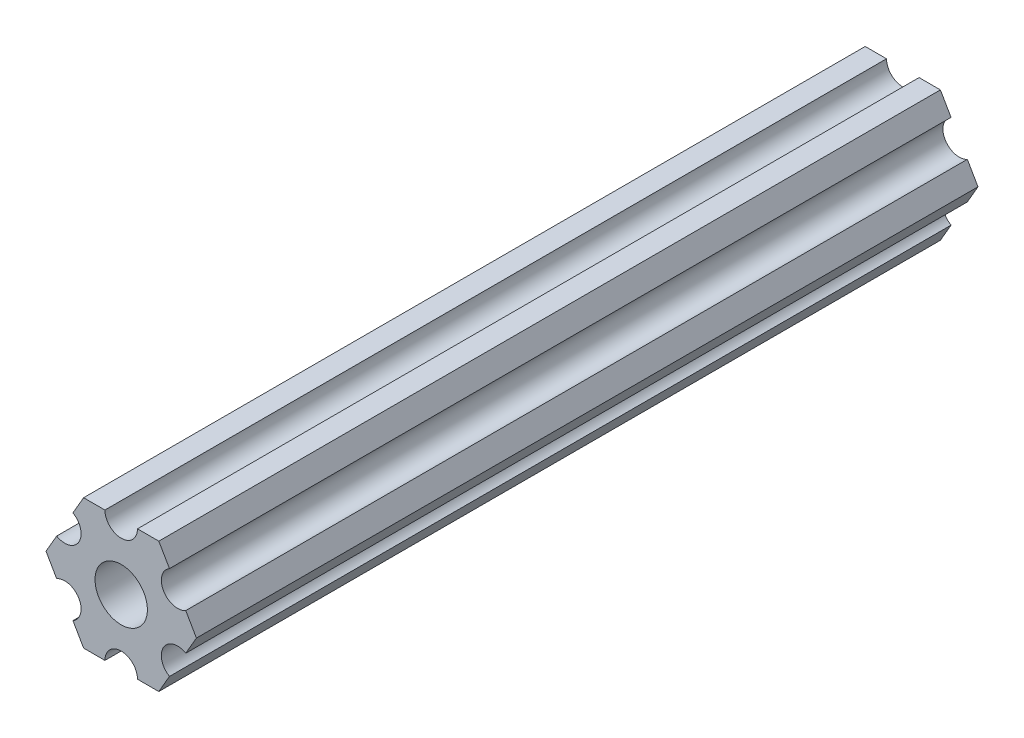
from build123d import *

# Parameters (mm, degrees)
BOSS_EXTRUDE1_DEPTH             = 76.2
F_1_4_20_START                  = -76.2
F_1_4_20_TAPPED_HOLE2_OUTLINE_R = 2.5527
F_1_4_20_TAPPED_HOLE2_DEPTH     = 76.2


# Read off the part's stored shape, not the designer's step: 1/4-20 Tapped Hole2
with BuildPart() as part:
    # Sketch1 → Boss-Extrude1 (new body)
    with BuildSketch(Plane.XY):
        with BuildLine():
            Line((-4.70551159, -4.549815043), (-3.666174521, -6.349999904))
            Line((-3.666174521, -6.349999904), (-1.587501923, -6.349999904))
            ThreePointArc((-1.587501923, -6.349999904), (-3.85e-07, -4.762498365), (1.587501923, -6.349999904))
            Line((1.587501923, -6.349999904), (3.666173825, -6.349999904))
            Line((3.666173825, -6.349999904), (4.705510929, -4.549815232))
            ThreePointArc((4.705510929, -4.549815232), (4.124445601, -2.381249904), (6.293010929, -1.800184575))
            Line((6.293010929, -1.800184575), (7.332348034, 9.6e-08))
            Line((7.332348034, 9.6e-08), (6.293011178, 1.800184715))
            ThreePointArc((6.293011178, 1.800184715), (4.124445902, 2.381250241), (4.705511428, 4.549815516))
            Line((4.705511428, 4.549815516), (3.666174521, 6.350000222))
            Line((3.666174521, 6.350000222), (1.587498077, 6.350000222))
            ThreePointArc((1.587498077, 6.350000222), (3.85e-07, 4.76250253), (-1.587498077, 6.350000222))
            Line((-1.587498077, 6.350000222), (-3.666173825, 6.350000222))
            Line((-3.666173825, 6.350000222), (-4.705511038, 4.549815614))
            ThreePointArc((-4.705511038, 4.549815614), (-4.124445841, 2.38125025), (-6.293011205, 1.800185053))
            Line((-6.293011205, 1.800185053), (-7.332348419, 4.44e-07))
            Line((-7.332348419, 4.44e-07), (-6.293011423, -1.80018429))
            ThreePointArc((-6.293011423, -1.80018429), (-4.12444613, -2.38124975), (-4.70551159, -4.549815043))
        make_face()
    extrude(amount=-BOSS_EXTRUDE1_DEPTH)

    # 1/4-20 Tapped Hole2 outline → 1/4-20 Tapped Hole2 (cut)
    with BuildSketch(Plane.XY.offset(F_1_4_20_START)):
        Circle(F_1_4_20_TAPPED_HOLE2_OUTLINE_R)
    extrude(amount=F_1_4_20_TAPPED_HOLE2_DEPTH, mode=Mode.SUBTRACT)


solid = part.part
